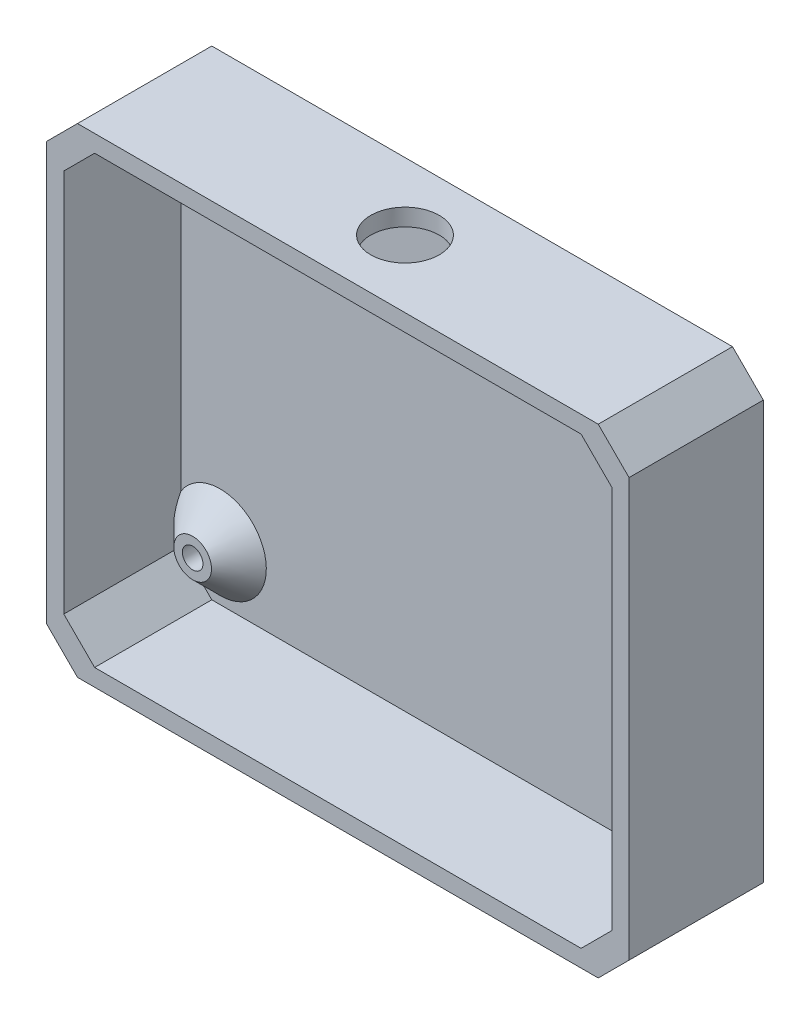
from build123d import *

# Parameters (mm, degrees)
ESQUISSE1_W             = 85
ESQUISSE1_H             = 70
BOSS_EXTRU_1_DEPTH      = 2.5
ESQUISSE2_W             = 85
ESQUISSE2_H             = 70
ESQUISSE2_W_2           = 80
ESQUISSE2_H_2           = 65
BOSS_EXTRU_2_DEPTH      = 17.1
ESQUISSE3_R             = 2.75
ESQUISSE3_R_2           = 1.5
BOSS_EXTRU_3_DEPTH      = 4
CHANFREIN1_SIZE         = 4.5
CHANFREIN2_SIZE         = 4
ESQUISSE4_R             = 5
ENL_V_MAT_EXTRU_1_DEPTH = 10


with BuildPart() as part:
    # Esquisse1 → Boss.-Extru.1 (new body)
    with BuildSketch(Plane.XY):
        with Locations((42.5, 35)):
            Rectangle(ESQUISSE1_W, ESQUISSE1_H)
    extrude(amount=BOSS_EXTRU_1_DEPTH)

    # Esquisse2 → Boss.-Extru.2 (add)
    with BuildSketch(Plane.XY.offset(2.5)):
        with Locations((42.5, 35)):
            Rectangle(ESQUISSE2_W, ESQUISSE2_H)
        with Locations((42.5, 35)):
            Rectangle(ESQUISSE2_W_2, ESQUISSE2_H_2, mode=Mode.SUBTRACT)
    extrude(amount=BOSS_EXTRU_2_DEPTH)

    # Esquisse3 → Boss.-Extru.3 (add)
    # profile 1 of 4: a face of its own
    with BuildSketch(Plane.XY.offset(2.5)):
        with Locations(Location((8.21, 61.19, 0), (0, 0, 180))):
            Circle(ESQUISSE3_R)
        with Locations((8.21, 61.19)):
            Circle(ESQUISSE3_R_2, mode=Mode.SUBTRACT)
    # profile 2 of 4: a face of its own
    with BuildSketch(Plane.XY.offset(2.5)):
        with Locations(Location((76.79, 61.19, 0), (0, 0, 180))):
            Circle(ESQUISSE3_R)
        with Locations((76.79, 61.19)):
            Circle(ESQUISSE3_R_2, mode=Mode.SUBTRACT)
    # profile 3 of 4: a face of its own
    with BuildSketch(Plane.XY.offset(2.5)):
        with Locations(Location((76.79, 10.39, 0), (0, 0, 180))):
            Circle(ESQUISSE3_R)
        with Locations((76.79, 10.39)):
            Circle(ESQUISSE3_R_2, mode=Mode.SUBTRACT)
    # profile 4 of 4: a face of its own
    with BuildSketch(Plane.XY.offset(2.5)):
        with Locations(Location((8.21, 10.39, 0), (0, 0, 180))):
            Circle(ESQUISSE3_R)
        with Locations((8.21, 10.39)):
            Circle(ESQUISSE3_R_2, mode=Mode.SUBTRACT)
    extrude(amount=BOSS_EXTRU_3_DEPTH)

    # Chanfrein1
    chanfrein1_edges = [part.edges().sort_by_distance(p)[0] for p in [
        (2.5, 67.5, 11.05),
        (2.5, 2.5, 11.05),
        (82.5, 2.5, 11.05),
        (82.5, 67.5, 11.05),
        (0, 70, 9.8),
        (85, 70, 9.8),
        (85, 0, 9.8),
        (0, 0, 9.8),
    ]]
    chamfer(chanfrein1_edges, length=CHANFREIN1_SIZE)

    # Chanfrein2
    # the kernel refuses this chamfer: 4 mm, written as the material it adds along each edge
    with BuildSketch(Plane(origin=(8.21, 10.39, 2.5), x_dir=(-1, 0, 0), z_dir=(0, 1, 0))) as chanfrein2_piece_1_section:
        Polygon((2.75 + CHANFREIN2_SIZE, 0), (2.75, CHANFREIN2_SIZE), (2.75, 0), align=None)
    chanfrein2_piece_1 = revolve(axis=Axis((8.21, 10.39, 2.5), (0, 0, 1)), mode=Mode.PRIVATE)
    chanfrein2_piece_1 = split(chanfrein2_piece_1, bisect_by=Plane(origin=(12.973571243, 10.39, 6.5), z_dir=(0, 0, -1)), keep=Keep.TOP, mode=Mode.PRIVATE)
    add(chanfrein2_piece_1)
    with BuildSketch(Plane(origin=(76.79, 10.39, 2.5), x_dir=(-1, 0, 0), z_dir=(0, 1, 0))) as chanfrein2_piece_2_section:
        Polygon((2.75 + CHANFREIN2_SIZE, 0), (2.75, CHANFREIN2_SIZE), (2.75, 0), align=None)
    chanfrein2_piece_2 = revolve(axis=Axis((76.79, 10.39, 2.5), (0, 0, 1)), mode=Mode.PRIVATE)
    chanfrein2_piece_2 = split(chanfrein2_piece_2, bisect_by=Plane(origin=(81.553571243, 10.39, 6.5), z_dir=(0, 0, -1)), keep=Keep.TOP, mode=Mode.PRIVATE)
    add(chanfrein2_piece_2)
    with BuildSketch(Plane(origin=(76.79, 61.19, 2.5), x_dir=(-1, 0, 0), z_dir=(0, 1, 0))) as chanfrein2_piece_3_section:
        Polygon((2.75 + CHANFREIN2_SIZE, 0), (2.75, CHANFREIN2_SIZE), (2.75, 0), align=None)
    chanfrein2_piece_3 = revolve(axis=Axis((76.79, 61.19, 2.5), (0, 0, 1)), mode=Mode.PRIVATE)
    chanfrein2_piece_3 = split(chanfrein2_piece_3, bisect_by=Plane(origin=(81.553571243, 61.19, 6.5), z_dir=(0, 0, -1)), keep=Keep.TOP, mode=Mode.PRIVATE)
    add(chanfrein2_piece_3)
    with BuildSketch(Plane(origin=(8.21, 61.19, 2.5), x_dir=(-1, 0, 0), z_dir=(0, 1, 0))) as chanfrein2_piece_4_section:
        Polygon((2.75 + CHANFREIN2_SIZE, 0), (2.75, CHANFREIN2_SIZE), (2.75, 0), align=None)
    chanfrein2_piece_4 = revolve(axis=Axis((8.21, 61.19, 2.5), (0, 0, 1)), mode=Mode.PRIVATE)
    chanfrein2_piece_4 = split(chanfrein2_piece_4, bisect_by=Plane(origin=(12.973571243, 61.19, 6.5), z_dir=(0, 0, -1)), keep=Keep.TOP, mode=Mode.PRIVATE)
    add(chanfrein2_piece_4)

    # Esquisse4 → Enlèv. mat.-Extru.1 (cut)
    with BuildSketch(Plane(origin=(0, 70, 0), x_dir=(1, 0, 0), z_dir=(0, 1, 0))):
        with Locations(Location((42.5, -9.8, 0), (0, 0, 270))):
            Circle(ESQUISSE4_R)
    extrude(amount=-ENL_V_MAT_EXTRU_1_DEPTH, mode=Mode.SUBTRACT)


solid = part.part
